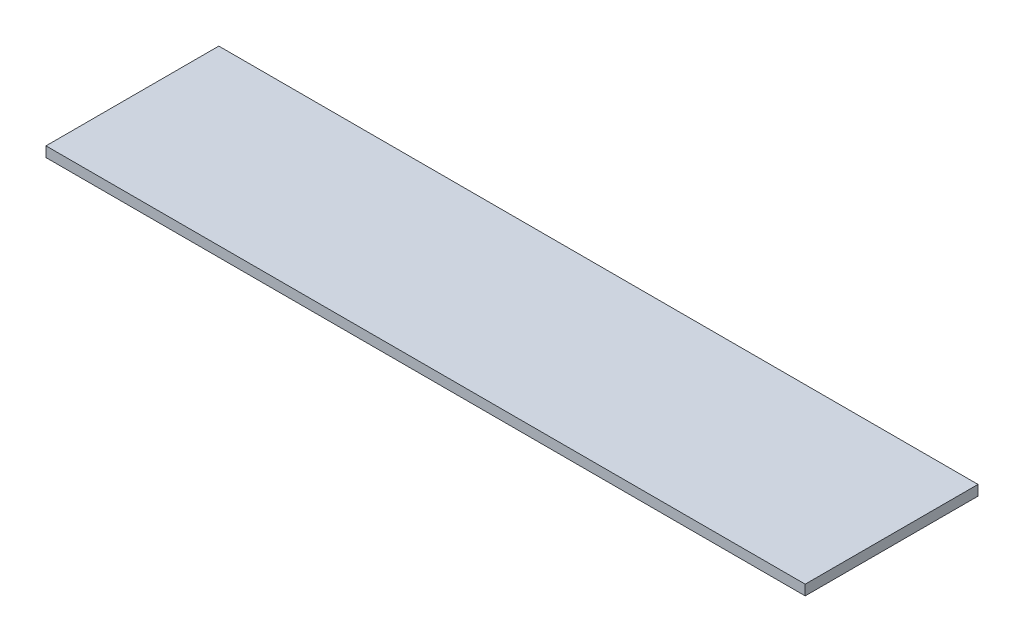
from build123d import *

# Parameters (mm, degrees)
SKETCH_1_W      = 134
SKETCH_1_H      = 30.5
EXTRUDE_1_DEPTH = 0.9


with BuildPart() as part:
    # Эскиз1 → Бобышка-Вытянуть1 (new, symmetric)
    with BuildSketch(Plane(origin=(0, 0, 0), x_dir=(1, 0, 0), z_dir=(0, 1, 0))):
        Rectangle(SKETCH_1_W, SKETCH_1_H)
    extrude(amount=EXTRUDE_1_DEPTH, both=True)


solid = part.part
